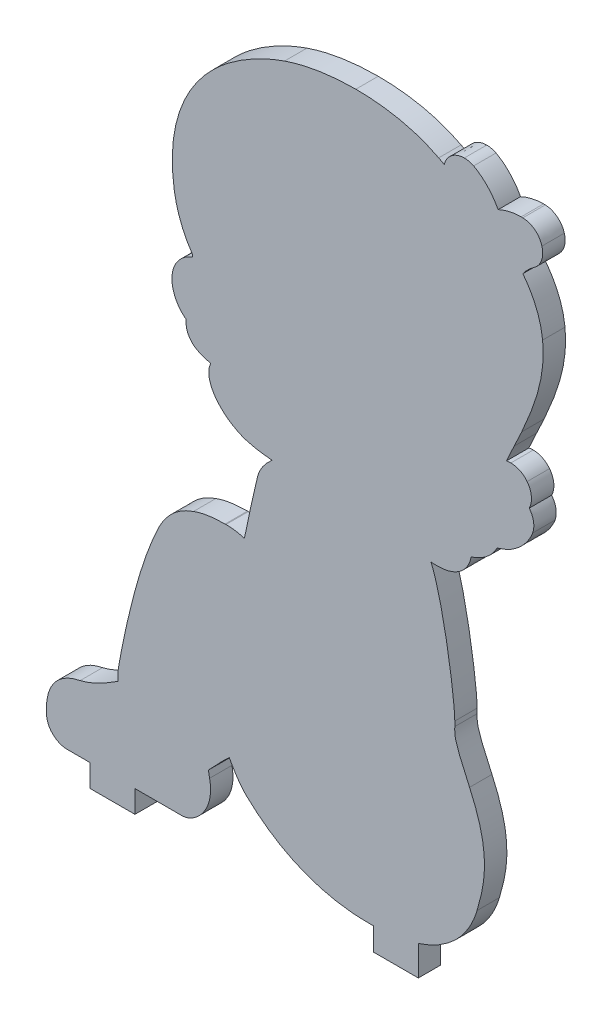
from build123d import *

# Parameters (mm, degrees)
BASE_FLANGE1_DEPTH = 2.3
SKETCH6_W          = 4.6
SKETCH6_H          = 2.3
SKETCH6_H_2        = 3.316029857
TAB1_DEPTH         = 2.3


# Sheet-metal steps are written as plain solids
with BuildPart() as part:
    # Model → Base-Flange1 (new body)
    with BuildSketch(Plane.XY):
        with BuildLine():
            Line((256.381443723, -381.176991685), (256.292861705, -381.177551513))
            add(Edge.make_bspline(
                [(256.292861705, -381.177551513), (254.729477374, -381.202959093), (253.945782746, -381.375343058), (253.044438108, -381.684583441)],
                knots=[19, 19, 19, 19, 20, 20, 20, 20], degree=3))
            add(Edge.make_bspline(
                [(253.044438108, -381.684583441), (251.484046704, -382.220941745), (250.336937566, -383.234316582), (249.536684949, -384.782887002)],
                knots=[20, 20, 20, 20, 21, 21, 21, 21], degree=3))
            add(Edge.make_bspline(
                [(249.536684949, -384.782887002), (248.69956981, -386.402168008), (247.741833265, -389.082409232), (246.974804287, -391.952302962)],
                knots=[21, 21, 21, 21, 22, 22, 22, 22], degree=3))
            add(Edge.make_bspline(
                [(246.974804287, -391.952302962), (246.008498067, -395.566552635), (245.484434448, -398.586910911), (245.388746921, -399.161251392)],
                knots=[22, 22, 22, 22, 23, 23, 23, 23], degree=3))
            add(Edge.make_bspline(
                [(245.388746921, -399.161251392), (245.324861931, -399.478458559), (245.243622273, -400.039750741), (245.296590617, -400.670719979)],
                knots=[23, 23, 23, 23, 24, 24, 24, 24], degree=3))
            add(Edge.make_bspline(
                [(245.296590617, -400.670719979), (244.018287937, -401.504648405), (242.528973158, -402.302833965), (241.414118728, -402.537186586)],
                knots=[24, 24, 24, 24, 25, 25, 25, 25], degree=3))
            add(Edge.make_bspline(
                [(241.414118728, -402.537186586), (238.329057252, -403.185209046), (237.831800783, -405.499753384), (237.957977405, -407.327290412)],
                knots=[25, 25, 25, 25, 26, 26, 26, 26], degree=3))
            add(Edge.make_bspline(
                [(237.957977405, -407.327290412), (238.035815031, -408.449056566), (238.97692899, -409.327297532), (240.100589946, -409.327297532)],
                knots=[26, 26, 26, 26, 27, 27, 27, 27], degree=3))
            Line((240.100589946, -409.327297532), (251.773133279, -409.330398118))
            add(Edge.make_bspline(
                [(251.773133279, -409.330398118), (252.109094684, -409.330398118), (252.44460392, -409.250299648), (252.743810463, -409.09875851)],
                knots=[28, 28, 28, 28, 29, 29, 29, 29], degree=3))
            add(Edge.make_bspline(
                [(252.743810463, -409.09875851), (253.699759865, -408.616574334), (255.190603404, -407.121359829), (254.698816024, -404.584003941)],
                knots=[29, 29, 29, 29, 30, 30, 30, 30], degree=3))
            Line((254.698816024, -404.584003941), (254.570163239, -403.919789531))
            add(Edge.make_bspline(
                [(254.570163239, -403.919789531), (254.84077549, -403.651158211), (255.136902978, -403.337955967), (255.478548791, -402.968684795)],
                knots=[31, 31, 31, 31, 32, 32, 32, 32], degree=3))
            add(Edge.make_bspline(
                [(255.478548791, -402.968684795), (255.730945099, -402.695962424), (255.985580719, -402.420785422), (256.147693994, -402.266875781)],
                knots=[32, 32, 32, 32, 33, 33, 33, 33], degree=3))
            add(Edge.make_bspline(
                [(256.147693994, -402.266875781), (256.285433218, -402.135919089), (256.451982053, -401.982655404), (256.633151011, -401.816171164)],
                knots=[33, 33, 33, 33, 34, 34, 34, 34], degree=3))
            add(Edge.make_bspline(
                [(256.633151011, -401.816171164), (256.661142412, -401.790419075), (256.688810835, -401.764925369), (256.71626394, -401.739603917)],
                knots=[34, 34, 34, 34, 35, 35, 35, 35], degree=3))
            add(Edge.make_bspline(
                [(256.71626394, -401.739603917), (257.318402035, -402.857365147), (257.889577335, -403.679838631), (258.423179562, -404.195784743)],
                knots=[35, 35, 35, 35, 36, 36, 36, 36], degree=3))
            add(Edge.make_bspline(
                [(258.423179562, -404.195784743), (261.87484226, -407.532402784), (266.224426033, -409.295947163), (271.001890666, -409.295947163)],
                knots=[36, 36, 36, 36, 37, 37, 37, 37], degree=3))
            add(Edge.make_bspline(
                [(271.001890666, -409.295947163), (276.917356464, -409.295947163), (280.879431591, -406.923611348), (282.158251035, -402.615950081)],
                knots=[37, 37, 37, 37, 38, 38, 38, 38], degree=3))
            add(Edge.make_bspline(
                [(282.158251035, -402.615950081), (283.035932173, -399.657861906), (283.584089929, -396.820739647), (281.392557031, -392.04333961)],
                knots=[38, 38, 38, 38, 39, 39, 39, 39], degree=3))
            add(Edge.make_bspline(
                [(281.392557031, -392.04333961), (279.85061842, -388.682175264), (279.856281295, -388.333919174), (279.871396652, -387.403097437)],
                knots=[39, 39, 39, 39, 40, 40, 40, 40], degree=3))
            add(Edge.make_bspline(
                [(279.871396652, -387.403097437), (279.873958942, -387.250522771), (279.876456636, -387.086450099), (279.876456636, -386.905927095)],
                knots=[40, 40, 40, 40, 41, 41, 41, 41], degree=3))
            add(Edge.make_bspline(
                [(279.876456636, -386.905927095), (279.876456636, -385.091567558), (278.766619125, -377.145110312), (277.435498825, -373.985613242)],
                knots=[41, 41, 41, 41, 42, 42, 42, 42], degree=3))
            add(Edge.make_bspline(
                [(277.435498825, -373.985613242), (277.54550503, -373.996982057), (277.6458865, -374.004389012), (277.735394387, -374.008953764)],
                knots=[42, 42, 42, 42, 43, 43, 43, 43], degree=3))
            add(Edge.make_bspline(
                [(277.735394387, -374.008953764), (277.843182812, -374.014379789), (277.945782062, -374.016791356), (278.044010347, -374.016791356)],
                knots=[43, 43, 43, 43, 44, 44, 44, 44], degree=3))
            add(Edge.make_bspline(
                [(278.044010347, -374.016791356), (280.493451705, -374.016791356), (281.390166996, -372.457584203), (281.53384901, -371.536322607)],
                knots=[44, 44, 44, 44, 45, 45, 45, 45], degree=3))
            add(Edge.make_bspline(
                [(281.53384901, -371.536322607), (281.536691214, -371.517116199), (281.539275035, -371.497952856), (281.541622007, -371.478789512)],
                knots=[45, 45, 45, 45, 46, 46, 46, 46], degree=3))
            add(Edge.make_bspline(
                [(281.541622007, -371.478789512), (282.791115076, -371.103360232), (283.658181014, -370.307543175), (284.078590322, -369.598887033)],
                knots=[46, 46, 46, 46, 47, 47, 47, 47], degree=3))
            add(Edge.make_bspline(
                [(284.078590322, -369.598887033), (284.127381487, -369.517152143), (284.170143735, -369.43270424), (284.206898597, -369.346189279)],
                knots=[47, 47, 47, 47, 48, 48, 48, 48], degree=3))
            add(Edge.make_bspline(
                [(284.206898597, -369.346189279), (284.269384016, -369.328920738), (284.331352671, -369.311049305), (284.392847626, -369.292488854)],
                knots=[48, 48, 48, 48, 49, 49, 49, 49], degree=3))
            add(Edge.make_bspline(
                [(284.392847626, -369.292488854), (286.984140791, -368.511571834), (287.787580121, -366.422595123), (287.870671518, -366.186993656)],
                knots=[49, 49, 49, 49, 50, 50, 50, 50], degree=3))
            add(Edge.make_bspline(
                [(287.870671518, -366.186993656), (288.115940785, -365.49659652), (287.981926571, -364.723689348), (287.521058922, -364.15288009)],
                knots=[50, 50, 50, 50, 51, 51, 51, 51], degree=3))
            add(Edge.make_bspline(
                [(287.521058922, -364.15288009), (287.886841935, -363.432295306), (287.807174102, -362.54380518), (287.30464233, -361.896299484)],
                knots=[51, 51, 51, 51, 52, 52, 52, 52], degree=3))
            add(Edge.make_bspline(
                [(287.30464233, -361.896299484), (286.907207502, -361.384142976), (286.281685821, -361.078240029), (285.631488644, -361.078153901)],
                knots=[52, 52, 52, 52, 53, 53, 53, 53], degree=3))
            add(Edge.make_bspline(
                [(285.631488644, -361.078153901), (285.478397213, -361.078153901), (285.326231652, -361.094625764), (285.177231272, -361.127268044)],
                knots=[53, 53, 53, 53, 54, 54, 54, 54], degree=3))
            add(Edge.make_bspline(
                [(285.177231272, -361.127268044), (285.392571272, -360.588864215), (285.731740922, -359.895388026), (285.967493113, -359.413397636)],
                knots=[54, 54, 54, 54, 55, 55, 55, 55], degree=3))
            add(Edge.make_bspline(
                [(285.967493113, -359.413397636), (286.235177032, -358.865735113), (286.50413133, -358.315445704), (286.749013024, -357.754218118)],
                knots=[55, 55, 55, 55, 56, 56, 56, 56], degree=3))
            add(Edge.make_bspline(
                [(286.749013024, -357.754218118), (287.812061831, -355.319633734), (289.268239097, -351.984716709), (288.892659094, -348.52185745)],
                knots=[56, 56, 56, 56, 57, 57, 57, 57], degree=3))
            add(Edge.make_bspline(
                [(288.892659094, -348.52185745), (288.648746334, -346.272856054), (287.623249067, -344.599637772), (286.860074289, -343.636625925)],
                knots=[57, 57, 57, 57, 58, 58, 58, 58], degree=3))
            add(Edge.make_bspline(
                [(286.860074289, -343.636625925), (287.091132537, -343.297822315), (287.519487097, -342.849572329), (287.97830922, -342.532838863)],
                knots=[58, 58, 58, 58, 59, 59, 59, 59], degree=3))
            add(Edge.make_bspline(
                [(287.97830922, -342.532838863), (288.738814049, -342.009744177), (289.074237158, -341.077845848), (288.823197356, -340.200336965)],
                knots=[60, 60, 60, 60, 61, 61, 61, 61], degree=3))
            add(Edge.make_bspline(
                [(288.823197356, -340.200336965), (288.570348879, -339.315485721), (287.782283287, -338.699028948), (286.862335133, -338.6668819)],
                knots=[61, 61, 61, 61, 62, 62, 62, 62], degree=3))
            add(Edge.make_bspline(
                [(286.862335133, -338.6668819), (286.800818647, -338.664922502), (286.745201887, -338.664061229), (286.690144955, -338.664061229)],
                knots=[62, 62, 62, 62, 63, 63, 63, 63], degree=3))
            add(Edge.make_bspline(
                [(286.690144955, -338.664061229), (285.895576745, -338.663996633), (285.095776296, -338.850053321), (284.326830984, -339.205328793)],
                knots=[63, 63, 63, 63, 64, 64, 64, 64], degree=3))
            add(Edge.make_bspline(
                [(284.326830984, -339.205328793), (283.39954047, -337.438985274), (282.01816484, -336.686834802), (281.808143206, -336.580252161)],
                knots=[64, 64, 64, 64, 65, 65, 65, 65], degree=3))
            add(Edge.make_bspline(
                [(281.808143206, -336.580252161), (281.510616147, -336.429981402), (281.180726723, -336.351368629), (280.85109568, -336.351368629)],
                knots=[65, 65, 65, 65, 66, 66, 66, 66], degree=3))
            add(Edge.make_bspline(
                [(280.85109568, -336.351368629), (280.076487492, -336.351282502), (279.364300128, -336.773500485), (278.992660453, -337.453239357)],
                knots=[66, 66, 66, 66, 67, 67, 67, 67], degree=3))
            add(Edge.make_bspline(
                [(278.992660453, -337.453239357), (278.903712394, -337.617290497), (278.838169452, -337.787349023), (278.794976567, -337.95951767)],
                knots=[67, 67, 67, 67, 68, 68, 68, 68], degree=3))
            Line((278.794976567, -337.95951767), (278.219990131, -337.657016755))
            add(Edge.make_bspline(
                [(278.219990131, -337.657016755), (275.305805392, -336.123755477), (271.987274102, -335.801832836), (269.716547072, -335.801789772)],
                knots=[69, 69, 69, 69, 70, 70, 70, 70], degree=3))
            add(Edge.make_bspline(
                [(269.716547072, -335.801789772), (267.133737455, -335.801746708), (264.531958281, -336.214167702), (262.390465395, -336.963066865)],
                knots=[1, 1, 1, 1, 2, 2, 2, 2], degree=3))
            add(Edge.make_bspline(
                [(262.390465395, -336.963066865), (260.402107004, -337.658373261), (257.525323083, -338.982129669), (255.112292078, -341.339802296)],
                knots=[2, 2, 2, 2, 3, 3, 3, 3], degree=3))
            add(Edge.make_bspline(
                [(255.112292078, -341.339802296), (252.057698166, -344.324353111), (250.604040126, -348.219227344), (250.908457375, -352.603348199)],
                knots=[3, 3, 3, 3, 4, 4, 4, 4], degree=3))
            add(Edge.make_bspline(
                [(250.908457375, -352.603348199), (250.981191954, -353.646781494), (251.167916129, -356.326505953), (252.916108301, -358.837334607)],
                knots=[4, 4, 4, 4, 5, 5, 5, 5], degree=3))
            add(Edge.make_bspline(
                [(252.916108301, -358.837334607), (252.927541712, -358.938491223), (252.937876998, -359.030130763), (252.946769651, -359.111585739)],
                knots=[5, 5, 5, 5, 6, 6, 6, 6], degree=3))
            add(Edge.make_bspline(
                [(252.946769651, -359.111585739), (252.43596965, -359.302939262), (251.973078008, -359.612136581), (251.615563224, -360.013748588)],
                knots=[6, 6, 6, 6, 7, 7, 7, 7], degree=3))
            add(Edge.make_bspline(
                [(251.615563224, -360.013748588), (250.796836282, -360.934644143), (250.605827269, -362.213635842), (251.103901949, -363.435912656)],
                knots=[7, 7, 7, 7, 8, 8, 8, 8], degree=3))
            add(Edge.make_bspline(
                [(251.103901949, -363.435912656), (251.370035575, -364.089145824), (251.782650355, -364.614135312), (252.298122767, -364.980994917)],
                knots=[8, 8, 8, 8, 9, 9, 9, 9], degree=3))
            add(Edge.make_bspline(
                [(252.298122767, -364.980994917), (252.268602605, -365.20570127), (252.274868372, -365.435575267), (252.318965594, -365.661315148)],
                knots=[9, 9, 9, 9, 10, 10, 10, 10], degree=3))
            add(Edge.make_bspline(
                [(252.318965594, -365.661315148), (252.431491026, -366.236215457), (252.780952899, -366.74294594), (253.277821795, -367.052186323)],
                knots=[10, 10, 10, 10, 11, 11, 11, 11], degree=3))
            add(Edge.make_bspline(
                [(253.277821795, -367.052186323), (253.451196226, -367.160319258), (253.963589584, -367.445099463), (254.81349464, -367.641039269)],
                knots=[11, 11, 11, 11, 12, 12, 12, 12], degree=3))
            add(Edge.make_bspline(
                [(254.81349464, -367.641039269), (254.638053152, -368.01577953), (254.569560348, -368.443272816), (254.637127283, -368.870421593)],
                knots=[12, 12, 12, 12, 13, 13, 13, 13], degree=3))
            add(Edge.make_bspline(
                [(254.637127283, -368.870421593), (254.926020071, -370.695547054), (256.895107459, -372.199158978), (258.601161807, -372.687458199)],
                knots=[13, 13, 13, 13, 14, 14, 14, 14], degree=3))
            add(Edge.make_bspline(
                [(258.601161807, -372.687458199), (259.372497155, -372.907685928), (260.261439449, -373.029383926), (261.107511837, -373.09354883)],
                knots=[14, 14, 14, 14, 15, 15, 15, 15], degree=3))
            add(Edge.make_bspline(
                [(261.107511837, -373.09354883), (260.419160227, -373.705957616), (259.827228227, -374.452251425), (259.622718746, -375.304223539)],
                knots=[15, 15, 15, 15, 16, 16, 16, 16], degree=3))
            add(Edge.make_bspline(
                [(259.622718746, -375.304223539), (259.172660085, -377.178872247), (258.668255042, -379.491866292), (258.2739208, -381.461384318)],
                knots=[16, 16, 16, 16, 17, 17, 17, 17], degree=3))
            add(Edge.make_bspline(
                [(258.2739208, -381.461384318), (257.673462189, -381.274100314), (257.037109989, -381.176991685), (256.381443723, -381.176991685)],
                knots=[17, 17, 17, 17, 18, 18, 18, 18], degree=3))
        make_face()
    extrude(amount=-BASE_FLANGE1_DEPTH)

    # Sketch6 → Tab1 (add)
    with BuildSketch(Plane.XY):
        with Locations((244.731700739, -410.477916747)):
            Rectangle(SKETCH6_W, SKETCH6_H)
        with Locations((273.831700739, -409.969901819)):
            Rectangle(SKETCH6_W, SKETCH6_H_2)
    extrude(amount=-TAB1_DEPTH)


solid = part.part
